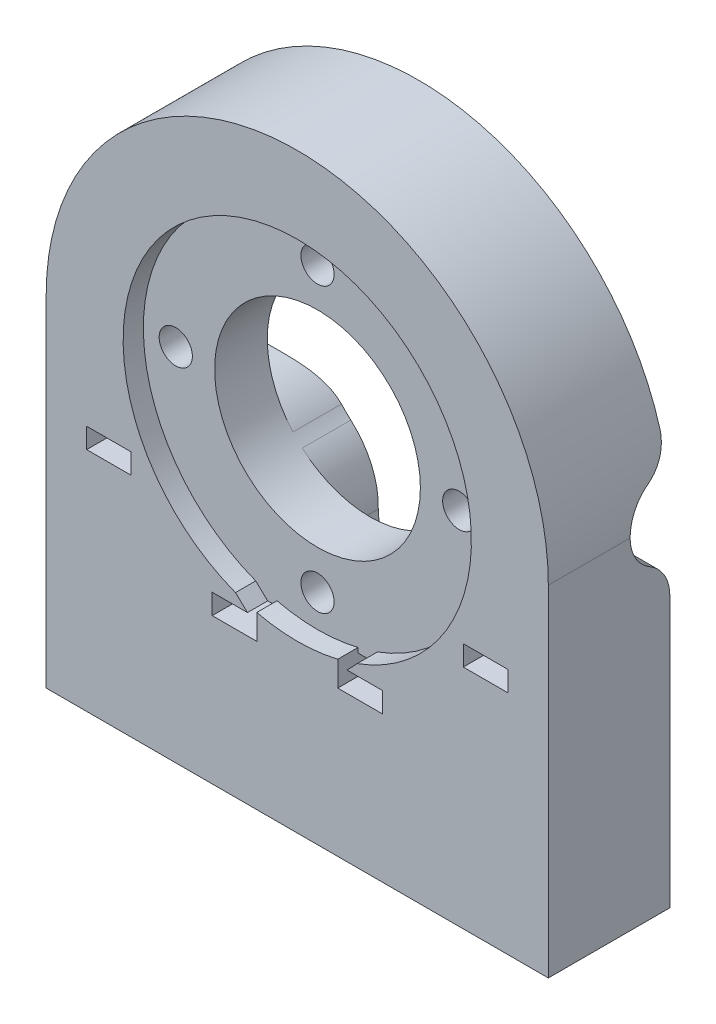
from build123d import *

# Parameters (mm, degrees)
SKETCH1_R                = 12.702118755
BOSS_EXTRUDE1_DEPTH      = 15
SKETCH1_3_R              = 5
CUT_EXTRUDE1_DEPTH       = 6
CUT_EXTRUDE3_DEPTH       = 81.715549927
CUT_EXTRUDE3_DEPTH_BACK  = 81.715549927
SKETCH1_4_R              = 2.05
FILLET1_R                = 10
CUT_EXTRUDE12_DEPTH      = 81.715550074
CUT_EXTRUDE12_DEPTH_BACK = 2.75
CUT_EXTRUDE12_START      = -7.5
SKETCH3_W                = 5.5
SKETCH3_H                = 2.5
CUT_EXTRUDE13_DEPTH      = 31.5
CUT_EXTRUDE14_DEPTH      = 21.5
CUT_EXTRUDE15_DEPTH      = 97.943282542
CUT_EXTRUDE15_DEPTH_BACK = 97.943282542
SKETCH4_R                = 5
FILLET2_R                = 5
CUT_EXTRUDE17_START      = -2.5
SKETCH6_R                = 2.05
SKETCH6_R_2              = 12.702118755
CUT_EXTRUDE17_DEPTH      = 2.5


with BuildPart() as part:
    # Sketch1 → Boss-Extrude1 (new body)
    with BuildSketch(Plane(origin=(0, 0, 0), x_dir=(0, 1, 0), z_dir=(0, 0, 1))):
        with BuildLine():
            Line((0, 31), (0, -31))
            Line((0, -31), (42, -31))
            ThreePointArc((42, -31), (73, 0), (42, 31))
            Line((42, 31), (0, 31))
        make_face()
        with Locations(Location((42, 0, 0), (0, 0, 270))):
            Circle(SKETCH1_R, mode=Mode.SUBTRACT)
    extrude(amount=BOSS_EXTRUDE1_DEPTH)

    # Sketch1<3> → Cut-Extrude1 (cut)
    with BuildSketch(Plane(origin=(0, 0, 0), x_dir=(0, 1, 0), z_dir=(0, 0, 1))):
        with Locations((59.5, 0)):
            Circle(SKETCH1_3_R)
        with Locations((42, -17.5)):
            Circle(SKETCH1_3_R)
        with Locations((24.5, 0)):
            Circle(SKETCH1_3_R)
        with Locations((42, 17.5)):
            Circle(SKETCH1_3_R)
    extrude(amount=CUT_EXTRUDE1_DEPTH, mode=Mode.SUBTRACT)

    # Sketch1<4> → Cut-Extrude3 (cut, two sides: drawn at the far end of the back side and taken through both)
    with BuildSketch(Plane(origin=(0, 0, 0), x_dir=(0, 1, 0), z_dir=(0, 0, 1)).offset(-CUT_EXTRUDE3_DEPTH_BACK)):
        with Locations(Location((59.5, 0, 0), (0, 0, 270))):
            Circle(SKETCH1_4_R)
        with Locations(Location((42, -17.5, 0), (0, 0, 270))):
            Circle(SKETCH1_4_R)
        with Locations(Location((24.5, 0, 0), (0, 0, 270))):
            Circle(SKETCH1_4_R)
        with Locations(Location((42, 17.5, 0), (0, 0, 270))):
            Circle(SKETCH1_4_R)
    extrude(amount=CUT_EXTRUDE3_DEPTH + CUT_EXTRUDE3_DEPTH_BACK, mode=Mode.SUBTRACT)

    # Fillet1
    fillet1_edges = [part.edges().sort_by_distance(p)[0] for p in [
        (-1.197579289, 29.354462261, 3),
        (1.197579289, 29.354462261, 3),
        (-12.645537739, 43.197579289, 3),
        (-12.645537739, 40.802420711, 3),
        (1.197579289, 54.645537739, 3),
        (-1.197579289, 54.645537739, 3),
        (12.645537739, 40.802420711, 3),
        (12.645537739, 43.197579289, 3),
    ]]
    fillet(fillet1_edges, radius=FILLET1_R)

    # Sketch3 → Cut-Extrude12 (cut, two sides: drawn at the far end of the back side and taken through both)
    with BuildSketch(Plane.XY.offset(15).offset(CUT_EXTRUDE12_START - CUT_EXTRUDE12_DEPTH_BACK)):
        with Locations((-23.25, 29.25)):
            Rectangle(SKETCH3_W, SKETCH3_H)
        with Locations((-7.75, 19.25)):
            Rectangle(SKETCH3_W, SKETCH3_H)
        with Locations((7.75, 19.25)):
            Rectangle(SKETCH3_W, SKETCH3_H)
        with Locations((23.25, 29.25)):
            Rectangle(SKETCH3_W, SKETCH3_H)
    extrude(amount=CUT_EXTRUDE12_DEPTH + CUT_EXTRUDE12_DEPTH_BACK, mode=Mode.SUBTRACT)

    # Sketch2 → Cut-Extrude13 (cut)
    with BuildSketch(Plane.XZ):
        with BuildLine():
            Line((-22.332277702, 6.189356729), (-23.25, 5.546760658))
            Line((-23.25, 5.546760658), (-24.167722298, 6.189356729))
            ThreePointArc((-24.167722298, 6.189356729), (-23.25, 9.1), (-22.332277702, 6.189356729))
        make_face()
        with BuildLine():
            Line((22.332277702, 6.189356729), (23.25, 5.546760658))
            Line((23.25, 5.546760658), (24.167722298, 6.189356729))
            ThreePointArc((24.167722298, 6.189356729), (23.25, 9.1), (22.332277702, 6.189356729))
        make_face()
    extrude(amount=-CUT_EXTRUDE13_DEPTH, mode=Mode.SUBTRACT)

    # Sketch2<3> → Cut-Extrude14 (cut)
    with BuildSketch(Plane.XZ):
        with BuildLine():
            Line((-8.667722298, 6.189356729), (-7.75, 5.546760658))
            Line((-7.75, 5.546760658), (-6.832277702, 6.189356729))
            ThreePointArc((-6.832277702, 6.189356729), (-7.75, 9.1), (-8.667722298, 6.189356729))
        make_face()
        with BuildLine():
            Line((6.832277702, 6.189356729), (7.75, 5.546760658))
            Line((7.75, 5.546760658), (8.667722298, 6.189356729))
            ThreePointArc((8.667722298, 6.189356729), (7.75, 9.1), (6.832277702, 6.189356729))
        make_face()
    extrude(amount=-CUT_EXTRUDE14_DEPTH, mode=Mode.SUBTRACT)

    # Sketch4 → Cut-Extrude15 (cut, two sides: drawn at the far end of the back side and taken through both)
    with BuildSketch(Plane(origin=(-31, 0, 0), x_dir=(0, -1, 0), z_dir=(-1, 0, 0)).offset(-CUT_EXTRUDE15_DEPTH_BACK)):
        with Locations((-42, -0.1)):
            Circle(SKETCH4_R)
    extrude(amount=CUT_EXTRUDE15_DEPTH + CUT_EXTRUDE15_DEPTH_BACK, mode=Mode.SUBTRACT)

    # Fillet2
    # the kernel refuses this fillet: 5 mm, written as the material it takes off along each edge
    with BuildSketch(Plane(origin=(-8.593139727, 37.0010001, 0), x_dir=(0, 0.2740416493582673, 0.9617178247370693), z_dir=(-1, 0, 0)), Plane(origin=(40.006860273, 37.0010001, 0), x_dir=(0, 0.2740416493582673, 0.9617178247370693), z_dir=(-1, 0, 0))) as fillet2_piece_1:
        with BuildLine():
            CenterArc((3.821287186, -4.835031475), FILLET2_R, 104.758918872, 59.336170258)
            Line((-0.987301938, -3.464823228), (0, 0))
            ThreePointArc((0, 0), (1.273762395, -0.164968525), (2.547524791, 0))
        make_face()
    extrude(amount=31.413720546, mode=Mode.SUBTRACT)
    with BuildSketch(Plane(origin=(-8.593139727, 46.9989999, 0), x_dir=(0, 1, 0), z_dir=(-1, 0, 0)), Plane(origin=(39.601140784, 46.9989999, 0), x_dir=(0, 1, 0), z_dir=(-1, 0, 0))) as fillet2_piece_2:
        with BuildLine():
            CenterArc((3.602744109, -5), FILLET2_R, 90, 59.336170258)
            ThreePointArc((-0.698127895, -2.45), (-0.190410776, -1.270208247), (0, 0))
            Line((0, 0), (3.602744109, 0))
        make_face()
    extrude(amount=31.008001057, mode=Mode.SUBTRACT)

    # Sketch6 → Cut-Extrude17 (cut)
    with BuildSketch(Plane.XY.offset(15).offset(CUT_EXTRUDE17_START)):
        with BuildLine():
            Line((-7.62767837, 21.898544265), (-6.15, 20.5))
            Line((-6.15, 20.5), (-5, 20.5))
            Line((-5, 20.5), (-5, 21.089476334))
            ThreePointArc((-5, 21.089476334), (0, 20.5), (5, 21.089476334))
            Line((5, 21.089476334), (5, 20.5))
            Line((5, 20.5), (6.15, 20.5))
            Line((6.15, 20.5), (7.389699175, 21.809845318))
            ThreePointArc((7.389699175, 21.809845318), (0.126985826, 63.499624987), (-7.62767837, 21.898544265))
        make_face()
        with Locations((0, 59.5)):
            Circle(SKETCH6_R, mode=Mode.SUBTRACT)
        with Locations((0, 24.5)):
            Circle(SKETCH6_R, mode=Mode.SUBTRACT)
        with Locations((-17.5, 42)):
            Circle(SKETCH6_R, mode=Mode.SUBTRACT)
        with Locations(Location((0, 42, 0), (0, 0, 221.332642507))):
            Circle(SKETCH6_R_2, mode=Mode.SUBTRACT)
        with Locations((17.5, 42)):
            Circle(SKETCH6_R, mode=Mode.SUBTRACT)
    extrude(amount=CUT_EXTRUDE17_DEPTH, mode=Mode.SUBTRACT)


solid = part.part
